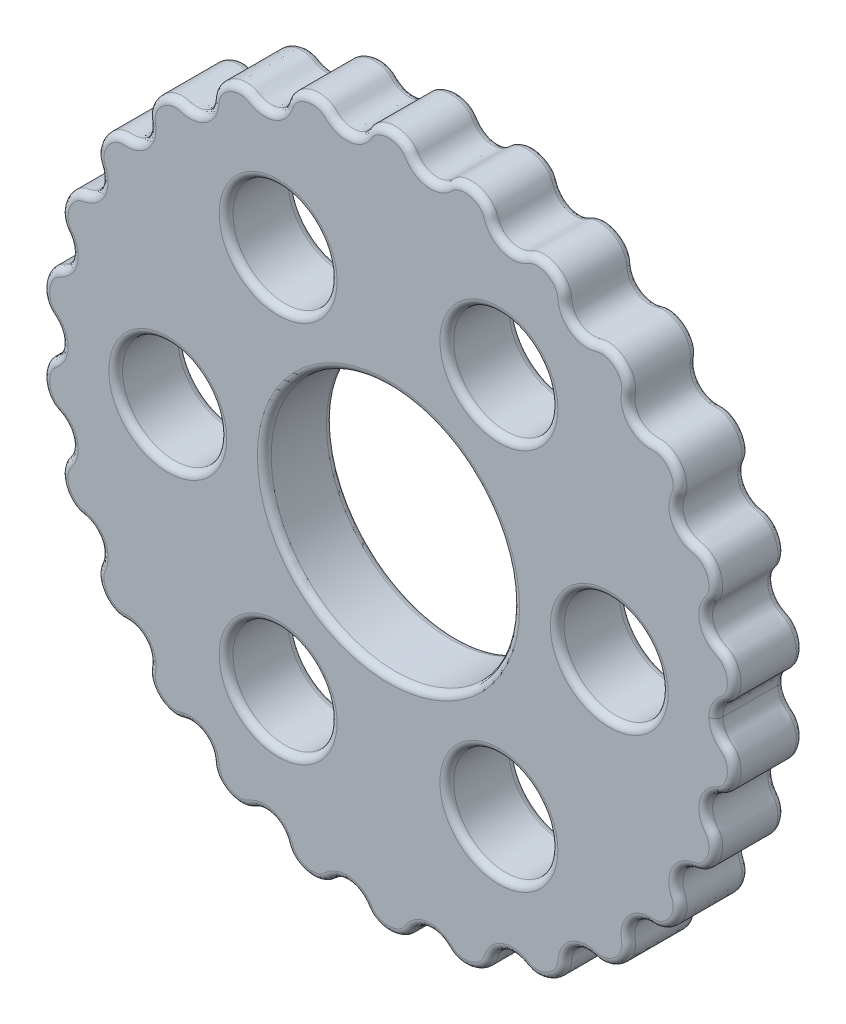
from build123d import *

# Parameters (mm, degrees)
SKETCH2_R           = 9.004300000000002
SKETCH2_R_2         = 3.775
SKETCH2_R_3         = 3.7750000000000012
SKETCH2_R_4         = 3.7750000000000004
BOSS_EXTRUDE1_DEPTH = 5
FILLET1_R           = 0.5


with BuildPart() as part:
    # Sketch2 → Boss-Extrude1 (new body)
    with BuildSketch(Plane.XY.offset(5.605325796761512)):
        with BuildLine():
            add(Edge.make_bspline(
                [(23.724999999999994, 1.00394499e-09), (23.725000000000254, -0.01217936427219428), (23.72533376441303, -0.0366706547715185), (23.72733633202933, -0.09315963064884239), (23.734339354882145, -0.18568859864513806), (23.748316103956885, -0.28029508179197876), (23.772156206137193, -0.39118526161436556), (23.803724847601277, -0.4995833910050419), (23.85259864354005, -0.6319371714409676), (23.93243835510342, -0.7985678999711547), (24.037119186571914, -0.960473165574779), (24.166410246651527, -1.1131967511698582), (24.295145333190625, -1.2378598188432834), (24.403795496609824, -1.3311850004743988), (24.514036765774307, -1.4226996482002274), (24.616683159713467, -1.522910505269511), (24.739724020924825, -1.6722365846883966), (24.866644215062156, -1.8806166561904083), (24.97750135352413, -2.153455340270601), (25.050003062752747, -2.4900286260400217), (25.06775934499675, -2.838602766513264), (25.029831935036754, -3.190470809704506), (24.934776722920688, -3.536595417296064), (24.78065605779558, -3.8663363708581366), (24.60055164223714, -4.118963377724676), (24.41926999483379, -4.299249118265738), (24.25725030950754, -4.418379863222768), (24.129784667898548, -4.49172043763832), (23.997372894155202, -4.555260035438568), (23.866757596152777, -4.622392322670064), (23.70903880002757, -4.716644726297933), (23.49705884382442, -4.875284244981644), (23.26020197070029, -5.130026955778072), (23.060008997689117, -5.5023493802766605), (22.96679728555848, -5.950849524340028), (22.99795876696649, -6.361995626900382), (23.09978508099704, -6.67479281028862), (23.218124880143584, -6.900114904750444), (23.31760031311298, -7.0521511665964525), (23.40351521083013, -7.1691854077061725), (23.487970578572142, -7.287482530435045), (23.560011221957375, -7.413905990530581), (23.637117861375316, -7.590273551856512), (23.702452421739054, -7.821150719692832), (23.74752038211547, -8.189522370593252), (23.704599322307722, -8.61534597153315), (23.57307778349332, -9.030281194446719), (23.35525824948975, -9.41396274911616), (23.12361309781731, -9.696558138035526), (22.885591777925022, -9.89725556853132), (22.66432806514558, -10.02677251336721), (22.477175705900162, -10.10124688920945), (22.335397096197664, -10.139967979883169), (22.191667043527303, -10.169709717141385), (22.049057366386073, -10.204676681542665), (21.873951510896855, -10.260028649815021), (21.625492513571253, -10.368455386380516), (21.326933461194812, -10.57113468053647), (21.043694752043734, -10.902298116106225), (20.85687224613663, -11.333762379257008), (20.805568254781782, -11.744716254072673), (20.84098922453726, -12.065316091619685), (20.907133671211955, -12.303351648966679), (20.967579673531873, -12.46558131706036), (21.02098808194754, -12.59325155953771), (21.082158248225213, -12.755311742026118), (21.13133823566493, -12.972622832756702), (21.145483847866142, -13.244426436043916), (21.094757549509982, -13.646112479725138), (20.947927415306914, -14.05103252472222), (20.71596863630784, -14.4247691982309), (20.405098785530377, -14.746856675772662), (20.102994781323442, -14.966460376886866), (19.814561091694618, -15.101900636791084), (19.560583235447208, -15.169611788078413), (19.35466337069549, -15.190269699429836), (19.222084349489844, -15.18880980107852), (19.108583412147205, -15.185507443050412), (18.995022992398425, -15.18525024532236), (18.88148930899362, -15.189479374264804), (18.711807190641405, -15.206526078231754), (18.443899413924, -15.264525015317425), (18.111722565752846, -15.40582504460612), (17.774162807692203, -15.67267233933793), (17.512085430298786, -16.048328821253595), (17.38061800962652, -16.427748268054387), (17.346842162590132, -16.736754291398984), (17.35744003812605, -16.975157202651644), (17.37811964659158, -17.141645065769584), (17.398825720177154, -17.274184774586054), (17.41712349923914, -17.441074939124736), (17.411560230096157, -17.660213960903477), (17.359779726782406, -17.92560689155175), (17.213164399141718, -18.303934361645062), (16.92964418985525, -18.7242290812596), (16.549705124102402, -19.061015738220853), (16.1012904941757, -19.290923311237083), (15.712735773032737, -19.391979394550496), (15.44375709173522, -19.413239219356978), (15.223611747044592, -19.39418310653709), (15.022753251926265, -19.34764753277964), (14.825284562320528, -19.289177483527205), (14.550383361738172, -19.236994839406478), (14.196156053614654, -19.234763793216864), (13.797581489186637, -19.32653510916186), (13.392939486314903, -19.550909245548233), (13.092705202602676, -19.860201937107938), (12.919058500596726, -20.17346117302806), (12.833622472566189, -20.431759539193393), (12.794747108656647, -20.61571805862812), (12.77426717186376, -20.764704720690933), (12.761487449089254, -20.91439927376842), (12.74326276323991, -21.063708168767867), (12.695384361897576, -21.26344153359526), (12.595724947134453, -21.50446755227773), (12.425630331270757, -21.77105068199347), (12.171565940920663, -22.040942977416076), (11.812908780612494, -22.309392948591665), (11.410847775981093, -22.493708516975826), (10.9862139531403, -22.588712779702654), (10.610130162943735, -22.58636932708437), (10.372131950600126, -22.54727837344824), (10.189220502705123, -22.490660309808753), (10.05844701672906, -22.434660808928854), (9.93382914001229, -22.36635938426155), (9.810008267505962, -22.296921150033103), (9.650716151829862, -22.21828678683302), (9.41893937002164, -22.129696668134446), (9.105269134714845, -22.065806439561193), (8.700424067737428, -22.07849384149272), (8.268126579497041, -22.21564767207595), (7.918456354111347, -22.452167425718386), (7.6877867058551494, -22.716263991078762), (7.55141842821744, -22.94568903906694), (7.474282994952195, -23.11406530221645), (7.421736765603976, -23.252487157985243), (7.3745336917356585, -23.392768637233527), (7.318730781960613, -23.530059295725106), (7.221639634500598, -23.70801837657055), (7.065464555755325, -23.913016831543587), (6.836222795151732, -24.12577553296135), (6.526198812759667, -24.321866575250013), (6.114362969531994, -24.49265841885348), (5.680120605802927, -24.572247322367282), (5.244595445015069, -24.559684628018704), (4.879445947070029, -24.46366067303406), (4.658119736223968, -24.36595110015641), (4.495055195646094, -24.264844705974706), (4.382767518549366, -24.177516575723484), (4.278858200659456, -24.08059424347693), (4.17472836054306, -23.984066510005796), (4.037883330281383, -23.870743891613028), (3.8273081719660227, -23.727899658520748), (3.5240746039461337, -23.590230104236433), (3.118318113929485, -23.515252457709654), (2.665805034643806, -23.560372793655997), (2.279152642792022, -23.715829447739633), (2.004936104359433, -23.915994502714565), (1.8238489808575407, -24.10522570265481), (1.709958650767573, -24.252462618169595), (1.626727579421464, -24.37576721985299), (1.546571541832778, -24.50112841582072), (1.4565485805309342, -24.61986232215082), (1.3206511837471104, -24.762248915291366), (1.1279070324569422, -24.913578276746723), (0.8711710660002935, -25.055465736368905), (0.5490602268328648, -25.16689460910151), (0.12072355735034832, -25.241828035290137), (-0.32051738882289327, -25.225615469069922), (-0.753533478841555, -25.115319625490343), (-1.1028118346221543, -24.93040140180376), (-1.3026662827526823, -24.778150170554284), (-1.440813747002337, -24.637504235703084), (-1.5299553008570095, -24.524920363612633), (-1.6083537250058764, -24.40482329039657), (-1.687102688814772, -24.285056401609918), (-1.7939789282264442, -24.141034213581083), (-1.9708870980615119, -23.945395672543274), (-2.247974979810432, -23.730990477535887), (-2.643571382119068, -23.56337718075824), (-3.1110092711368176, -23.513900884718943), (-3.524073754349752, -23.590230594276736), (-3.8273086718619203, -23.727899356439114), (-4.0378830233025615, -23.870744079540035), (-4.17472853281086, -23.984066403283734), (-4.27885810680729, -24.080594301017758), (-4.382767554684887, -24.17751655293459), (-4.49505518036968, -24.264844714974824), (-4.658119743080236, -24.365951095475037), (-4.879445941504952, -24.463660676040814), (-5.244595447925236, -24.559684625797725), (-5.680120602172107, -24.57224732420968), (-6.114362970029197, -24.492658418163447), (-6.526198810889709, -24.32186657604622), (-6.836222794734681, -24.125775532877068), (-7.0654645544018795, -23.913016832054158), (-7.2216396336787865, -23.70801837676434), (-7.318730780864842, -23.530059296097416), (-7.374533690819762, -23.39276863750063), (-7.421736764580816, -23.252487158324392), (-7.474282993988806, -23.114065302524583), (-7.55141842724009, -22.945689039391123), (-7.687786704896606, -22.716263991403153), (-7.9184563531575565, -22.45216742605602), (-8.2681265785568, -22.21564767242581), (-8.700424066800394, -22.078493841861714), (-9.105269133779919, -22.06580643994604), (-9.418939369083214, -22.129696668532773), (-9.650716150888591, -22.218286787240693), (-9.810008266561052, -22.296921150447666), (-9.933829139064807, -22.36635938468122), (-10.058447015778553, -22.434660809354), (-10.189220501752335, -22.490660310239495), (-10.372131949644992, -22.547278373887014), (-10.610130161987001, -22.58636932753322), (-10.986213952183727, -22.58871278016776), (-11.410847775028719, -22.49370851745882), (-11.812908779668183, -22.3093929490918), (-12.171565939987664, -22.040942977931334), (-12.425630330349403, -21.77105068251944), (-12.595724946224264, -21.50446755281099), (-12.695384360997753, -21.26344153413271), (-12.743262762348472, -21.06370816930733), (-12.761487448204266, -20.91439927430864), (-12.774267170984988, -20.76470472123169), (-12.794747107784278, -20.615718059169726), (-12.833622471701483, -20.431759539736618), (-12.919058499743048, -20.173461173574857), (-13.092705201762085, -19.860201937662193), (-13.392939485487549, -19.55090924611504), (-13.79758148836849, -19.326535109745816), (-14.196156052800715, -19.234763793817628), (-14.550383360923883, -19.23699484002214), (-14.825284561504333, -19.289177484154596), (-15.022753251107444, -19.347647533415344), (-15.223611746223927, -19.394183107181348), (-15.443757090913712, -19.413239220010446), (-15.712735772212179, -19.391979395215444), (-16.10129049335951, -19.29092331191839), (-16.54970512329596, -19.06101573892105), (-16.92964418906326, -18.724229081975746), (-17.213164398367468, -18.30393436237287), (-17.359779726024144, -17.925606892285515), (-17.411560229348975, -17.66021396163917), (-17.417123498501063, -17.441074939860616), (-17.398825719445952, -17.274184775320975), (-17.378119645866015, -17.14164506650364), (-17.357440037407585, -16.975157203384644), (-17.346842161881938, -16.736754292131458), (-17.38061800893174, -16.427748268788022), (-17.512085429620537, -16.048328821992964), (-17.77416280703043, -15.672672340088601), (-18.111722565102514, -15.405825045371548), (-18.443899413279865, -15.264525016097387), (-18.71180718999949, -15.206526079023261), (-18.881489308352545, -15.189479375063737), (-18.995022991757402, -15.185250246126133), (-19.108583411506128, -15.185507443859073), (-19.22208434884866, -15.188809801891976), (-19.354663370054073, -15.190269700248814), (-19.560583234806707, -15.169611788905865), (-19.814561091056667, -15.10190063762912), (-20.10299478069104, -14.966460377736972), (-20.405098784907043, -14.74685667663556), (-20.71596863569804, -14.424769199106738), (-20.94792741471285, -14.051032525607631), (-21.094757548932975, -13.646112480616285), (-21.14548384730579, -13.244426436936717), (-21.1313382351157, -12.972622833648515), (-21.08215824768473, -12.755311742915783), (-21.02098808141349, -12.593251560424601), (-20.967579673003346, -12.465581317944926), (-20.907133670690154, -12.303351649848272), (-20.84098922402621, -12.065316092498248), (-20.80556825428462, -11.74471625494907), (-20.85687224565826, -11.333762380135635), (-21.04369475158452, -10.902298116993135), (-21.326933460750546, -10.571134681436359), (-21.62549251313554, -10.368455387293855), (-21.873951510465833, -10.260028650739558), (-22.049057365957136, -10.204676682474835), (-22.19166704309994, -10.169709718079895), (-22.33539709577124, -10.139967980827679), (-22.47717570547534, -10.101246890159798), (-22.664328064723303, -10.026772514325117), (-22.885591777508235, -9.897255569498437), (-23.123613097408118, -9.696558139012602), (-23.35525824909247, -9.413962750103103), (-23.57307778311168, -9.03028119544275), (-23.704599321943697, -8.615345972534369), (-23.747520381768958, -8.189522371595785), (-23.702452421407536, -7.821150720692824), (-23.63711786105308, -7.5902735528535255), (-23.56001122164189, -7.413905991524177), (-23.487970578261663, -7.287482531425617), (-23.403515210524134, -7.169185408693109), (-23.317600312812022, -7.052151167579504), (-23.218124879849007, -6.900114905728791), (-23.09978508071272, -6.674792811261209), (-22.997958766695874, -6.361995627867772), (-22.966797285307262, -5.9508495253055695), (-23.060008997458276, -5.5023493812465505), (-23.260201970486904, -5.130026956757394), (-23.497058843622124, -4.875284245972315), (-23.709038799832143, -4.716644727298389), (-23.866757595961346, -4.622392323677783), (-23.99737289396637, -4.55526003645213), (-24.129784667712357, -4.491720438657501), (-24.257250309323805, -4.418379864247053), (-24.419269994654776, -4.299249119296596), (-24.600551642064776, -4.118963378763114), (-24.780656057633554, -3.866336371904241), (-24.934776722771666, -3.536595418349025), (-25.029831934902194, -3.190470810761775), (-25.067759344876563, -2.8386027675724765), (-25.050003062647207, -2.490028627098693), (-24.977501353432707, -2.1534553413263926), (-24.86664421498203, -1.880616657241697), (-24.739724020853522, -1.6722365857344876), (-24.616683159648414, -1.5229105063105532), (-24.51403676571351, -1.4226996492370707), (-24.40379549655289, -1.3311850015066224), (-24.29514533313783, -1.2378598198709598), (-24.166410246604038, -1.1131967521921204), (-24.03711918653108, -0.960473166591621), (-23.932438355069483, -0.7985679009836165), (-23.85259864351318, -0.6319371724501108), (-23.803724847580117, -0.4995833920121601), (-23.772156206120563, -0.3911852626202036), (-23.748316103944905, -0.28029508279731224), (-23.734339354875548, -0.1856885996447212), (-23.727336332028685, -0.09315963177913823), (-23.72533376441988, -0.03667065596827916), (-23.725000000003252, -0.01217936553366124), (-23.724999999999998, -3.4150706e-10)],
                knots=[0.06809268294698215, 0.06809268294698215, 0.06809268294698215, 0.06809268294698215, 0.06809268294698215, 0.06863496962252245, 0.06917725631203173, 0.07026182969105027, 0.07134640307006881, 0.07243097644908736, 0.0735155498281059, 0.07460012320712445, 0.07676926996516154, 0.07952348057894598, 0.0809005858858382, 0.08227769119273043, 0.08365479649962265, 0.08503190180651488, 0.0864090071134071, 0.08778611242029932, 0.09108115111229637, 0.09437618980429341, 0.09767122849629045, 0.1009662671882875, 0.10444822297400233, 0.10793017875971717, 0.111412134545432, 0.11489409033114684, 0.11630587957720771, 0.11771766882326859, 0.11912945806932948, 0.12054124731539036, 0.12195303656145123, 0.12336482580751212, 0.12618840429963388, 0.1306984792165251, 0.13520855413341637, 0.13938877197002375, 0.14356898980663116, 0.14636160323869346, 0.1477579099547246, 0.14915421667075573, 0.15055052338678687, 0.151946830102818, 0.15334313681884915, 0.15473944353488028, 0.15793978157151387, 0.16114011960814745, 0.16754079568141464, 0.1710363107968527, 0.17453182591229074, 0.1780273410277288, 0.18152285614316685, 0.18293405953568403, 0.1843452629282012, 0.18575646632071838, 0.18716766971323556, 0.18857887310575275, 0.18999007649826993, 0.1928124832833043, 0.19756667661368027, 0.20232086994405626, 0.2064802370782283, 0.21063960421240033, 0.2133014615265038, 0.21463239018355554, 0.21596331884060727, 0.217294247497659, 0.21862517615471072, 0.2212870334688142, 0.22449414388580152, 0.2277012543027888, 0.2341154751367634, 0.23768730638504904, 0.24125913763333465, 0.24483096888162026, 0.2484028001299059, 0.24985857294947594, 0.251314345769046, 0.25277011858861603, 0.253498004998401, 0.2542258914081861, 0.2556816642277561, 0.25713743704732617, 0.2600489826864663, 0.2647374424314831, 0.2694259021765, 0.2734272438123597, 0.27742858544821947, 0.28000858287081076, 0.2812985815821064, 0.28258858029340206, 0.2838785790046977, 0.28516857771599335, 0.2877485751385846, 0.2909839344417161, 0.29421929374484757, 0.3006900123511106, 0.3070506788141225, 0.31023101204562853, 0.3134113452771345, 0.3160514424147688, 0.3173714909835859, 0.31869153955240304, 0.32133163669003734, 0.32397173382767164, 0.32809501711061406, 0.33221830039355654, 0.3368719274191556, 0.34152555444475474, 0.3444151044102704, 0.3458598793930282, 0.34730465437578606, 0.34874942935854386, 0.35019420434130166, 0.3516389793240595, 0.3530837543068173, 0.3566289784842339, 0.3601742026616505, 0.3637194268390671, 0.3672646510164837, 0.37377401692775536, 0.37702869988339116, 0.380283382839027, 0.3816486725859942, 0.38301396233296137, 0.38437925207992857, 0.38574454182689577, 0.387109831573863, 0.3884751213208302, 0.3912057008147646, 0.3952665138376338, 0.39932732686050304, 0.40387275583761584, 0.4084181848147286, 0.41126423522985184, 0.41268726043741344, 0.4141102856449751, 0.41553331085253675, 0.41695633606009835, 0.41837936126765995, 0.4198023864752216, 0.4233115624284193, 0.42682073838161694, 0.4303299143348146, 0.4338390902880122, 0.4403759364412063, 0.44364435951780334, 0.44691278259440037, 0.4482782098520295, 0.44964363710965866, 0.4510090643672878, 0.45237449162491694, 0.45373991888254606, 0.45510534614017517, 0.45783620065543346, 0.46213901255730944, 0.4664418244591854, 0.470767867946211, 0.4750939114332366, 0.4779543664322519, 0.4793845939317596, 0.48081482143126725, 0.4822450489307749, 0.4836752764302826, 0.48510550392979024, 0.4865357314292979, 0.48979838053741453, 0.4930610296455312, 0.49632367875364786, 0.4995863278617645, 0.5064508977697255, 0.509883182723706, 0.5133154676776864, 0.5146937594586036, 0.5160720512395207, 0.5174503430204379, 0.5188286348013551, 0.5202069265822722, 0.5215852183631894, 0.5243418019250237, 0.5289500274464051, 0.5335582529677865, 0.5378610648696642, 0.5421638767715419, 0.5448947312868015, 0.5462601585444314, 0.5476255858020613, 0.5489910130596912, 0.5503564403173211, 0.5517218675749509, 0.5530872948325808, 0.5563557179091796, 0.5596241409857784, 0.566160987138976, 0.5696701630921723, 0.5731793390453686, 0.5766885149985649, 0.5801976909517612, 0.5816207161593222, 0.5830437413668832, 0.5844667665744442, 0.5858897917820052, 0.5873128169895662, 0.5887358421971272, 0.5915818926122492, 0.5961273215893593, 0.6006727505664694, 0.6047335635893405, 0.6087943766122115, 0.6115249561061473, 0.6128902458531152, 0.6142555356000832, 0.6156208253470511, 0.616986115094019, 0.6183514048409869, 0.6197166945879549, 0.6229713775435924, 0.62622606049923, 0.6327354264105052, 0.6362806505879219, 0.6398258747653387, 0.6433710989427555, 0.6469163231201721, 0.6483610981029302, 0.6498058730856882, 0.6512506480684461, 0.6526954230512041, 0.6541401980339621, 0.65558497301672, 0.658474522982236, 0.6631281500078344, 0.6677817770334329, 0.6719050603163761, 0.6760283435993194, 0.678668440736954, 0.6813085378745886, 0.6826285864434058, 0.6839486350122231, 0.6865887321498577, 0.689769065381364, 0.6929493986128703, 0.6993100650758829, 0.7057807836821499, 0.7090161429852834, 0.7122515022884168, 0.7148314997110097, 0.7161214984223061, 0.7174114971336024, 0.7187014958448987, 0.7199914945561952, 0.722571491978788, 0.7265728336146502, 0.7305741752505123, 0.7352626349955275, 0.7399510947405427, 0.7428626403796816, 0.7443184131992511, 0.7457741860188206, 0.7465020724286053, 0.7472299588383902, 0.7486857316579596, 0.750141504477529, 0.7515972772970986, 0.7551691085453824, 0.7587409397936663, 0.7623127710419502, 0.765884602290234, 0.7722988231242163, 0.7755059335412074, 0.7787130439581986, 0.7813749012723055, 0.7827058299293588, 0.7840367585864122, 0.7853676872434656, 0.7866986159005189, 0.7893604732146258, 0.7935198403488027, 0.7976792074829797, 0.802433400813351, 0.8071875941437223, 0.8100100009287539, 0.8114212043212696, 0.8128324077137855, 0.8142436111063014, 0.8156548144988172, 0.8170660178913329, 0.8184772212838487, 0.8219727363992836, 0.8254682515147185, 0.8289637666301534, 0.8324592817455883, 0.838859957818866, 0.842060295855505, 0.8452606338921439, 0.8466569406081774, 0.8480532473242111, 0.8494495540402446, 0.8508458607562781, 0.8522421674723117, 0.8536384741883453, 0.8564310876204124, 0.8606113054570277, 0.8647915232936431, 0.8693015982105272, 0.8738116731274114, 0.8766352516195286, 0.8780470408655872, 0.8794588301116457, 0.8808706193577043, 0.882282408603763, 0.8836941978498216, 0.8851059870958802, 0.8885879428815899, 0.8920698986672996, 0.8955518544530092, 0.899033810238719, 0.9023288489307146, 0.9056238876227104, 0.9089189263147062, 0.9122139650067018, 0.9135910703135932, 0.9149681756204846, 0.916345280927376, 0.9177223862342674, 0.9190994915411588, 0.9204765968480502, 0.9232308074618331, 0.9253999542198694, 0.9264845275988877, 0.9275691009779059, 0.9286536743569241, 0.9297382477359424, 0.9308228211149605, 0.9313651078044696, 0.9319073944939787, 0.9319073944939787, 0.9319073944939787, 0.9319073944939787, 0.9319073944939787], degree=4))
            add(Edge.make_bspline(
                [(23.724999999999994, 1.00394499e-09), (23.72500000000784, 0.01217936509097278), (23.72533376442805, 0.03667065545904508), (23.727336332046207, 0.0931596311382066), (23.734339354879825, 0.18568859889624095), (23.748316103953385, 0.28029508204325626), (23.772156206132312, 0.39118526186594077), (23.803724847595035, 0.49958339125701134), (23.85259864353216, 0.6319371716935472), (23.932438355093456, 0.7985679002247312), (24.037119186559924, 0.9604731658296626), (24.16641024663763, 1.1131967514263559), (24.295145333175167, 1.237859819101389), (24.4037954965932, 1.331185000733861), (24.514036765756543, 1.4226996484610661), (24.616683159694453, 1.5229105055316314), (24.73972402090395, 1.6722365849520535), (24.866644215038676, 1.8806166564556501), (24.977501353497242, 2.1534553405372265), (25.050003062721657, 2.4900286263075526), (25.067759344961303, 2.8386027667810168), (25.02983193499692, 3.190470809971785), (24.934776722876524, 3.536595417562156), (24.780656057747297, 3.866336371122304), (24.600551642185707, 4.118963377986595), (24.4192699947801, 4.299249118525395), (24.257250309452374, 4.418379863480401), (24.12978466784246, 4.491720437894361), (23.99737289409832, 4.555260035692957), (23.86675759609506, 4.62239232292282), (23.709038799968678, 4.71664472654872), (23.49705884376354, 4.875284245229784), (23.26020197063623, 5.130026956023253), (23.060008997620407, 5.502349380519343), (22.966797285484173, 5.950849524581548), (22.997958766887052, 6.361995627142291), (23.099785080913698, 6.674792810531801), (23.218124880057424, 6.900114904995102), (23.31760031302492, 7.052151166842352), (23.403515210740608, 7.169185407953145), (23.48797057848115, 7.2874825306830715), (23.560011221864798, 7.413905990779508), (23.63711786128054, 7.590273552106402), (23.70245242164139, 7.821150719943536), (23.74752038201321, 8.189522370844522), (23.704599322200146, 8.615345971783883), (23.573077783380565, 9.030281194695808), (23.355258249372206, 9.413962749362529), (23.123613097696232, 9.696558138279), (22.88559177780144, 9.897255568771824), (22.664328065020374, 10.026772513604952), (22.477175705774034, 10.101246889444855), (22.335397096071052, 10.139967980116806), (22.191667043400315, 10.169709717373225), (22.049057366258648, 10.204676681772726), (21.87395151076874, 10.260028650042896), (21.62549251344178, 10.368455386605286), (21.326933461062808, 10.571134680757513), (21.043694751907598, 10.90229811632373), (20.85687224599511, 11.33376237947218), (20.80556825463513, 11.744716254287205), (20.840989224386604, 12.06531609183466), (20.907133671058325, 12.303351649182481), (20.96757967337622, 12.465581317276914), (21.020988081790286, 12.593251559754933), (21.082158248065937, 12.755311742244102), (21.131338235502948, 12.9726228329753), (21.145483847700763, 13.24442643626269), (21.094757549339587, 13.646112479943282), (20.947927415131467, 14.05103252493853), (20.715968636127716, 14.424769198444313), (20.405098785346237, 14.746856675982194), (20.102994781136562, 14.966460377092627), (19.814561091506047, 15.101900636993241), (19.56058323525779, 15.169611788277399), (19.35466337050581, 15.190269699626253), (19.222084349300182, 15.188809801273282), (19.108583411957586, 15.185507443243756), (18.995022992208813, 15.185250245514283), (18.881489308803953, 15.18947937445531), (18.711807190451527, 15.206526078420143), (18.4438994137334, 15.264525015502468), (18.111722565560473, 15.405825044787015), (17.774162807496506, 15.672672339514609), (17.5120854300984, 16.048328821427003), (17.380618009421386, 16.427748268226154), (17.346842162381144, 16.73675429157033), (17.35744003791409, 16.97515720282312), (17.378119646377534, 17.141645065941326), (17.398825719961458, 17.274184774758048), (17.417123499021354, 17.44107493929696), (17.411560229875636, 17.660213961075634), (17.359779726558575, 17.925606891723262), (17.21316439891316, 18.30393436181474), (16.929644189621445, 18.72422908142574), (16.549705123864396, 19.06101573838225), (16.101290493934822, 19.290923311392874), (15.712735772790595, 19.39197939470144), (15.443757091492813, 19.413239219504558), (15.223611746802423, 19.394183106681922), (15.022753251684675, 19.347647532921965), (14.82528456207967, 19.289177483667068), (14.550383361497968, 19.236994839542906), (14.196156053374477, 19.234763793348865), (13.797581488945314, 19.32653510928889), (13.392939486070777, 19.55090924567021), (13.09270520235469, 19.86020193722616), (12.919058500344825, 20.173461173144112), (12.833622472311065, 20.431759539308384), (12.794747108399225, 20.615718058742623), (12.77426717160448, 20.764704720805184), (12.761487448828102, 20.91439927388251), (12.743262762976896, 21.06370816888173), (12.695384361632065, 21.263441533708523), (12.595724946865934, 21.504467552389748), (12.425630330998908, 21.771050682103365), (12.171565940645444, 22.040942977522803), (11.812908780333924, 22.309392948693908), (11.410847775700223, 22.49370851707305), (10.986213952858243, 22.588712779794573), (10.610130162661706, 22.586369327171592), (10.372131950318584, 22.547278373532492), (10.18922050242429, 22.490660309890725), (10.058447016448927, 22.43466080900919), (9.933829139733009, 22.366359384340328), (9.81000826722755, 22.29692115011034), (9.650716151552427, 22.218286786908266), (9.418939369745315, 22.1296966682068), (9.105269134439316, 22.065806439629633), (8.700424067461743, 22.078493841556103), (8.26812657921964, 22.215647672133933), (7.918456353830993, 22.452167425772), (7.687786705571499, 22.716263991129498), (7.551418427930925, 22.945689039115976), (7.474282994663577, 23.114065302264517), (7.42173676531363, 23.252487158032654), (7.37453369144356, 23.39276863728035), (7.318730781666801, 23.53005929577123), (7.221639634204564, 23.708018376615467), (7.065464555456732, 23.913016831586553), (6.836222794850481, 24.12577553300145), (6.5261988124559664, 24.321866575286244), (6.114362969226163, 24.49265841888457), (5.680120605496101, 24.572247322392947), (5.244595444708399, 24.559684628038934), (4.87944594676456, 24.463660673049727), (4.658119735919719, 24.365951100169315), (4.495055195343106, 24.264844705985578), (4.38276751824747, 24.17751657573295), (4.278858200358769, 24.080594243485105), (4.174728360243579, 23.98406651001267), (4.037883329983316, 23.870743891618186), (3.8273081716697397, 23.727899658523278), (3.5240746036515698, 23.59023010423518), (3.1183181136358575, 23.515252457703333), (2.6658050343496145, 23.560372793644024), (2.2791526424958897, 23.715829447722836), (2.004936104060801, 23.91599450269434), (1.8238489805565463, 24.105225702632328), (1.70995865046474, 24.252462618145685), (1.6267275791170916, 24.37576721982804), (1.5465715415268402, 24.50112841579477), (1.4565485802235134, 24.61986232212375), (1.320651183437912, 24.762248915262592), (1.1279070321458544, 24.913578276715548), (0.8711710656874337, 25.055465736334522), (0.5490602265186139, 25.166894609063107), (0.12072355703516151, 25.24182803524638), (-0.32051738913787753, 25.22561546902066), (-0.7535334791551621, 25.115319625435674), (-1.1028118349334526, 24.93040140174473), (-1.3026662830620792, 24.77815017049276), (-1.4408137473099778, 24.63750423563983), (-1.5299553011632445, 24.524920363548265), (-1.6083537253106117, 24.40482329033123), (-1.687102689118012, 24.285056401543592), (-1.7939789285278855, 24.141034213513425), (-1.970887098360511, 23.945395672473403), (-2.247974980106754, 23.73099047746256), (-2.6435713824132963, 23.563377180679975), (-3.1110092714304285, 23.51390088463484), (-3.5240737546443164, 23.59023059418747), (-3.8273086721582033, 23.727899356346068), (-4.037883023600628, 23.870744079444357), (-4.1747285331103425, 23.984066403186343), (-4.278858107107976, 24.080594300919063), (-4.382767554986783, 24.177516552834604), (-4.495055180672668, 24.264844714873437), (-4.658119743384485, 24.365951095371614), (-4.879445941810421, 24.46366067593463), (-5.244595448231906, 24.559684625686977), (-5.680120602478934, 24.572247324093496), (-6.114362970335029, 24.49265841804184), (-6.526198811193409, 24.32186657591947), (-6.836222795035932, 24.12577553274645), (-7.0654645547004735, 23.91301683192067), (-7.221639633974821, 23.708018376628907), (-7.318730781158654, 23.530059295960772), (-7.374533691111861, 23.39276863736329), (-7.421736764871161, 23.252487158186458), (-7.474282994277424, 23.114065302386), (-7.551418427526606, 22.945689039251572), (-7.687786705180256, 22.7162639912619), (-7.91845635343791, 22.452167425911888), (-8.2681265788342, 22.21564767227731), (-8.700424067076082, 22.07849384170781), (-9.105269134055447, 22.065806439787085), (-9.418939369359537, 22.129696668369903), (-9.650716151166026, 22.21828678707493), (-9.810008266839466, 22.296921150279914), (-9.933829139344088, 22.36635938451192), (-10.058447016058686, 22.434660809183143), (-10.189220502033168, 22.490660310067007), (-10.372131949926533, 22.547278373712246), (-10.61013016226903, 22.586369327355474), (-10.986213952465786, 22.588712779985322), (-11.41084777530959, 22.493708517271077), (-11.812908779946751, 22.30939294889904), (-12.171565940262884, 22.04094297773409), (-12.425630330621251, 21.77105068231903), (-12.595724946492785, 21.504467552608453), (-12.695384361263264, 21.26344153392893), (-12.743262762611488, 21.063708169102952), (-12.761487448465418, 20.91439927410403), (-12.774267171244267, 20.76470472102692), (-12.794747108041701, 20.615718058964703), (-12.833622471956607, 20.431759539531107), (-12.919058499994948, 20.17346117336828), (-13.092705202010071, 19.86020193745345), (-13.392939485731675, 19.550909245902545), (-13.797581488609813, 19.32653510952827), (-14.196156053040893, 19.234763793595107), (-14.550383361164089, 19.236994839795198), (-14.825284561745189, 19.289177483924213), (-15.022753251349034, 19.3476475331825), (-15.223611746466096, 19.394183106945995), (-15.44375709115612, 19.413239219772347), (-15.712735772454321, 19.39197939497398), (-16.10129049360039, 19.29092331167208), (-16.54970512353397, 19.061015738669138), (-16.92964418929707, 18.72422908171909), (-17.213164398596025, 18.303934362112678), (-17.359779726247975, 17.92560689202349), (-17.411560229569496, 17.660213961376492), (-17.417123498718848, 17.441074939597875), (-17.398825719661648, 17.274184775058462), (-17.37811964608006, 17.14164506624138), (-17.357440037619547, 16.97515720312265), (-17.346842162090926, 16.736754291869595), (-17.38061800913687, 16.42774826852574), (-17.512085429820925, 16.048328821729037), (-17.774162807226126, 15.672672339821405), (-18.111722565294883, 15.405825045100132), (-18.443899413470465, 15.264525015821823), (-18.71180719018937, 15.206526078744352), (-18.881489308542214, 15.18947937478271), (-18.995022991947014, 15.185250245843688), (-19.108583411695747, 15.185507443575208), (-19.222084349038322, 15.188809801606693), (-19.35466337024375, 15.190269699961878), (-19.560583234996123, 15.169611788616358), (-19.81456109124524, 15.101900637336442), (-20.102994780877925, 14.96646037744069), (-20.405098785091184, 14.746856676335506), (-20.71596863587816, 14.424769198802803), (-20.9479274148883, 14.051032525300801), (-21.09475754910337, 13.64611248030762), (-21.14548384747117, 13.24442643662742), (-21.13133823527768, 12.972622833339393), (-21.082158247844006, 12.755311742607278), (-21.020988081570742, 12.593251560116856), (-20.967579673159, 12.46558131763785), (-20.907133670843784, 12.30335164954195), (-20.840989224176866, 12.065316092192752), (-20.80556825443127, 11.744716254644018), (-20.856872245799778, 11.333762379829942), (-21.04369475172066, 10.90229811668511), (-21.326933460882547, 10.571134681124793), (-21.62549251326501, 10.368455386978564), (-21.873951510593944, 10.260028650421164), (-22.049057366084558, 10.204676682154252), (-22.19166704322693, 10.169709717757534), (-22.335397095897854, 10.139967980503522), (-22.477175705601468, 10.10124688983387), (-22.664328064848505, 10.026772513996853), (-22.885591777631817, 9.897255569167411), (-23.123613097529194, 9.696558138678606), (-23.355258249210014, 9.413962749766213), (-23.57307778322443, 9.030281195103138), (-23.704599322051273, 8.615345972193117), (-23.74752038187122, 8.189522371253995), (-23.702452421505196, 7.821150720351598), (-23.63711786114786, 7.590273552513117), (-23.560011221734467, 7.41390599118473), (-23.48797057835266, 7.287482531087071), (-23.40351521061365, 7.1691854083556175), (-23.317600312900087, 7.052151167243085), (-23.218124879935168, 6.900114905393613), (-23.099785080796064, 6.674792810927509), (-22.99795876677531, 6.361995627535344), (-22.96679728538157, 5.95084952497353), (-23.060008997526985, 5.502349380913348), (-23.26020197055096, 5.130026956421692), (-23.497058843683003, 4.8752842456336545), (-23.709038799891037, 4.716644726957082), (-23.866757596019063, 4.622392323334507), (-23.997372894023254, 4.555260036107222), (-24.129784667768448, 4.49172043831094), (-24.25725030937897, 4.418379863898901), (-24.41926999470846, 4.29924911894642), (-24.60055164211621, 4.118963378410676), (-24.780656057681835, 3.866336371549552), (-24.934776722815826, 3.536595417992411), (-25.02983193494203, 3.190470810403975), (-25.067759344912012, 2.8386027672142022), (-25.050003062678297, 2.4900286267406413), (-24.977501353459594, 2.153455340969246), (-24.866644215005515, 1.8806166568859342), (-24.739724020874398, 1.6722365853803098), (-24.616683159667428, 1.522910505957912), (-24.514036765731273, 1.422699648885711), (-24.403795496569515, 1.3311850011566393), (-24.295145333153286, 1.2378598195223331), (-24.166410246617936, 1.1131967518451018), (-24.03711918654307, 0.9604731662462167), (-23.932438355079448, 0.7985679006395192), (-23.852598643521066, 0.6319371721070105), (-23.803724847586356, 0.49958339166967), (-23.772156206125445, 0.3911852622781077), (-23.748316103948405, 0.28029508245551404), (-23.734339354877868, 0.1856885993030975), (-23.727336332029846, 0.093159631437602), (-23.725333764420338, 0.03667065562676793), (-23.7250000000034, 0.01217936519215418), (-23.724999999999998, -3.4150706e-10)],
                knots=[0.06809268293301318, 0.06809268293301318, 0.06809268293301318, 0.06809268293301318, 0.06809268293301318, 0.06863496962252245, 0.06917725631203173, 0.07026182969105027, 0.07134640307006881, 0.07243097644908736, 0.0735155498281059, 0.07460012320712445, 0.07676926996516154, 0.07952348057894598, 0.0809005858858382, 0.08227769119273043, 0.08365479649962265, 0.08503190180651488, 0.0864090071134071, 0.08778611242029932, 0.09108115111229637, 0.09437618980429341, 0.09767122849629045, 0.1009662671882875, 0.10444822297400233, 0.10793017875971717, 0.111412134545432, 0.11489409033114684, 0.11630587957720771, 0.11771766882326859, 0.11912945806932948, 0.12054124731539036, 0.12195303656145123, 0.12336482580751212, 0.12618840429963388, 0.1306984792165251, 0.13520855413341637, 0.13938877197002375, 0.14356898980663116, 0.14636160323869346, 0.1477579099547246, 0.14915421667075573, 0.15055052338678687, 0.151946830102818, 0.15334313681884915, 0.15473944353488028, 0.15793978157151387, 0.16114011960814745, 0.16754079568141464, 0.1710363107968527, 0.17453182591229074, 0.1780273410277288, 0.18152285614316685, 0.18293405953568403, 0.1843452629282012, 0.18575646632071838, 0.18716766971323556, 0.18857887310575275, 0.18999007649826993, 0.1928124832833043, 0.19756667661368027, 0.20232086994405626, 0.2064802370782283, 0.21063960421240033, 0.2133014615265038, 0.21463239018355554, 0.21596331884060727, 0.217294247497659, 0.21862517615471072, 0.2212870334688142, 0.22449414388580152, 0.2277012543027888, 0.2341154751367634, 0.23768730638504904, 0.24125913763333465, 0.24483096888162026, 0.2484028001299059, 0.24985857294947594, 0.251314345769046, 0.25277011858861603, 0.253498004998401, 0.2542258914081861, 0.2556816642277561, 0.25713743704732617, 0.2600489826864663, 0.2647374424314831, 0.2694259021765, 0.2734272438123597, 0.27742858544821947, 0.28000858287081076, 0.2812985815821064, 0.28258858029340206, 0.2838785790046977, 0.28516857771599335, 0.2877485751385846, 0.2909839344417161, 0.29421929374484757, 0.3006900123511106, 0.3070506788141225, 0.31023101204562853, 0.3134113452771345, 0.3160514424147688, 0.3173714909835859, 0.31869153955240304, 0.32133163669003734, 0.32397173382767164, 0.32809501711061406, 0.33221830039355654, 0.3368719274191556, 0.34152555444475474, 0.3444151044102704, 0.3458598793930282, 0.34730465437578606, 0.34874942935854386, 0.35019420434130166, 0.3516389793240595, 0.3530837543068173, 0.3566289784842339, 0.3601742026616505, 0.3637194268390671, 0.3672646510164837, 0.37377401692775536, 0.37702869988339116, 0.380283382839027, 0.3816486725859942, 0.38301396233296137, 0.38437925207992857, 0.38574454182689577, 0.387109831573863, 0.3884751213208302, 0.3912057008147646, 0.3952665138376338, 0.39932732686050304, 0.40387275583761584, 0.4084181848147286, 0.41126423522985184, 0.41268726043741344, 0.4141102856449751, 0.41553331085253675, 0.41695633606009835, 0.41837936126765995, 0.4198023864752216, 0.4233115624284193, 0.42682073838161694, 0.4303299143348146, 0.4338390902880122, 0.4403759364412063, 0.44364435951780334, 0.44691278259440037, 0.4482782098520295, 0.44964363710965866, 0.4510090643672878, 0.45237449162491694, 0.45373991888254606, 0.45510534614017517, 0.45783620065543346, 0.46213901255730944, 0.4664418244591854, 0.470767867946211, 0.4750939114332366, 0.4779543664322519, 0.4793845939317596, 0.48081482143126725, 0.4822450489307749, 0.4836752764302826, 0.48510550392979024, 0.4865357314292979, 0.48979838053741453, 0.4930610296455312, 0.49632367875364786, 0.4995863278617645, 0.5064508977697255, 0.509883182723706, 0.5133154676776864, 0.5146937594586036, 0.5160720512395207, 0.5174503430204379, 0.5188286348013551, 0.5202069265822722, 0.5215852183631894, 0.5243418019250237, 0.5289500274464051, 0.5335582529677865, 0.5378610648696642, 0.5421638767715419, 0.5448947312868015, 0.5462601585444314, 0.5476255858020613, 0.5489910130596912, 0.5503564403173211, 0.5517218675749509, 0.5530872948325808, 0.5563557179091796, 0.5596241409857784, 0.566160987138976, 0.5696701630921723, 0.5731793390453686, 0.5766885149985649, 0.5801976909517612, 0.5816207161593222, 0.5830437413668832, 0.5844667665744442, 0.5858897917820052, 0.5873128169895662, 0.5887358421971272, 0.5915818926122492, 0.5961273215893593, 0.6006727505664694, 0.6047335635893405, 0.6087943766122115, 0.6115249561061473, 0.6128902458531152, 0.6142555356000832, 0.6156208253470511, 0.616986115094019, 0.6183514048409869, 0.6197166945879549, 0.6229713775435924, 0.62622606049923, 0.6327354264105052, 0.6362806505879219, 0.6398258747653387, 0.6433710989427555, 0.6469163231201721, 0.6483610981029302, 0.6498058730856882, 0.6512506480684461, 0.6526954230512041, 0.6541401980339621, 0.65558497301672, 0.658474522982236, 0.6631281500078344, 0.6677817770334329, 0.6719050603163761, 0.6760283435993194, 0.678668440736954, 0.6813085378745886, 0.6826285864434058, 0.6839486350122231, 0.6865887321498577, 0.689769065381364, 0.6929493986128703, 0.6993100650758829, 0.7057807836821499, 0.7090161429852834, 0.7122515022884168, 0.7148314997110097, 0.7161214984223061, 0.7174114971336024, 0.7187014958448987, 0.7199914945561952, 0.722571491978788, 0.7265728336146502, 0.7305741752505123, 0.7352626349955275, 0.7399510947405427, 0.7428626403796816, 0.7443184131992511, 0.7457741860188206, 0.7465020724286053, 0.7472299588383902, 0.7486857316579596, 0.750141504477529, 0.7515972772970986, 0.7551691085453824, 0.7587409397936663, 0.7623127710419502, 0.765884602290234, 0.7722988231242163, 0.7755059335412074, 0.7787130439581986, 0.7813749012723055, 0.7827058299293588, 0.7840367585864122, 0.7853676872434656, 0.7866986159005189, 0.7893604732146258, 0.7935198403488027, 0.7976792074829797, 0.802433400813351, 0.8071875941437223, 0.8100100009287539, 0.8114212043212696, 0.8128324077137855, 0.8142436111063014, 0.8156548144988172, 0.8170660178913329, 0.8184772212838487, 0.8219727363992836, 0.8254682515147185, 0.8289637666301534, 0.8324592817455883, 0.838859957818866, 0.842060295855505, 0.8452606338921439, 0.8466569406081774, 0.8480532473242111, 0.8494495540402446, 0.8508458607562781, 0.8522421674723117, 0.8536384741883453, 0.8564310876204124, 0.8606113054570277, 0.8647915232936431, 0.8693015982105272, 0.8738116731274114, 0.8766352516195286, 0.8780470408655872, 0.8794588301116457, 0.8808706193577043, 0.882282408603763, 0.8836941978498216, 0.8851059870958802, 0.8885879428815899, 0.8920698986672996, 0.8955518544530092, 0.899033810238719, 0.9023288489307146, 0.9056238876227104, 0.9089189263147062, 0.9122139650067018, 0.9135910703135932, 0.9149681756204846, 0.916345280927376, 0.9177223862342674, 0.9190994915411588, 0.9204765968480502, 0.9232308074618331, 0.9253999542198694, 0.9264845275988877, 0.9275691009779059, 0.9286536743569241, 0.9297382477359424, 0.9308228211149605, 0.9313651078044696, 0.9319073944939787, 0.9319073944939787, 0.9319073944939787, 0.9319073944939787, 0.9319073944939787], degree=4))
        make_face()
        Circle(SKETCH2_R, mode=Mode.SUBTRACT)
        with Locations((7.999999999999967, 13.856406460551037)):
            Circle(SKETCH2_R_2, mode=Mode.SUBTRACT)
        with Locations((16.000000000000007, -8.7e-16)):
            Circle(SKETCH2_R_3, mode=Mode.SUBTRACT)
        with Locations((7.999999999999967, -13.856406460551037)):
            Circle(SKETCH2_R_2, mode=Mode.SUBTRACT)
        with Locations((-8.000000000000066, -13.856406460550984)):
            Circle(SKETCH2_R_4, mode=Mode.SUBTRACT)
        with Locations((-16, 1.1276e-13)):
            Circle(SKETCH2_R_3, mode=Mode.SUBTRACT)
        with Locations((-7.9999999999998685, 13.856406460551094)):
            Circle(SKETCH2_R_4, mode=Mode.SUBTRACT)
    extrude(amount=-BOSS_EXTRUDE1_DEPTH)

    # Fillet1
    fillet1_edges = [part.edges().sort_by_distance(p)[0] for p in [
        (-3.0865229097e-07, -25.22499851157603, 5.605325796761512),
        (-3.0865229097e-07, -25.22499851157603, 0.6053257967615124),
        (-3.1001625459e-07, 25.22499851153077, 5.605325796761512),
        (-3.1001625459e-07, 25.22499851153077, 0.6053257967615124),
        (-9.004300000000002, 4.4e-16, 5.605325796761512),
        (-9.004300000000002, 4.4e-16, 0.6053257967615124),
        (4.224999999999968, 13.856406460551037, 5.605325796761512),
        (4.224999999999968, 13.856406460551037, 0.6053257967615124),
        (12.225000000000005, -1.06e-15, 5.605325796761512),
        (12.225000000000005, -1.06e-15, 0.6053257967615124),
        (4.224999999999968, -13.856406460551037, 5.605325796761512),
        (4.224999999999968, -13.856406460551037, 0.6053257967615124),
        (-11.775000000000066, -13.856406460550984, 5.605325796761512),
        (-11.775000000000066, -13.856406460550984, 0.6053257967615124),
        (-19.775000000000002, 1.1256e-13, 5.605325796761512),
        (-19.775000000000002, 1.1256e-13, 0.6053257967615124),
        (-11.774999999999869, 13.856406460551094, 5.605325796761512),
        (-11.774999999999869, 13.856406460551094, 0.6053257967615124),
    ]]
    fillet(fillet1_edges, radius=FILLET1_R)


solid = part.part
